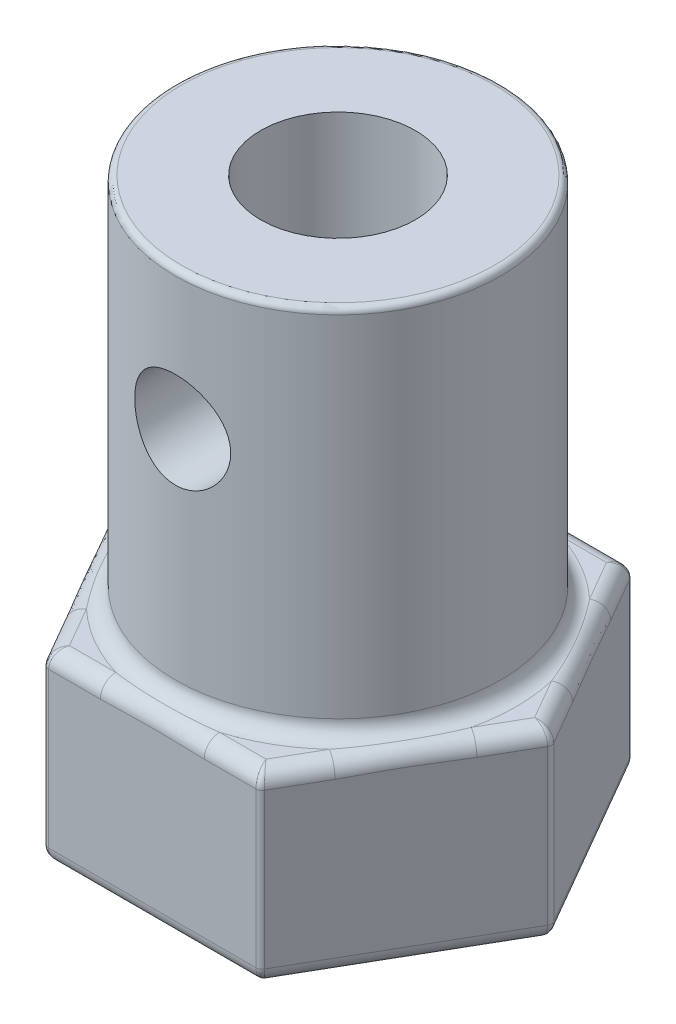
from build123d import *

# Parameters (mm, degrees)
SKETCH_1_R               = 2
EXTRUDE_1_DEPTH          = 6
SKETCH_2_R               = 5.25
SKETCH_2_R_2             = 2.5
EXTRUDE_2_DEPTH          = 12
CUT_EXTRUDE_1_DEPTH      = 21.199009877
CUT_EXTRUDE_1_DEPTH_BACK = 21.199009877
SKETCH_3_R               = 1.55
FILLET_1_R               = 0.5
FILLET_2_R               = 0.5
FILLET_3_R               = 0.2
FILLET_4_R               = 0.2


with BuildPart() as part:
    # 草图1 → 凸台-拉伸1 (new body)
    with BuildSketch(Plane(origin=(0, 0, 0), x_dir=(1, 0, 0), z_dir=(0, 1, 0))):
        Polygon((6.92820323, 0), (3.464101615, 6), (-3.464101615, 6), (-6.92820323, 0), (-3.464101615, -6), (3.464101615, -6), align=None)
        with Locations(Location((0, 0, 0), (0, 0, 270))):
            Circle(SKETCH_1_R, mode=Mode.SUBTRACT)
    extrude(amount=EXTRUDE_1_DEPTH)

    # 草图2 → 凸台-拉伸2 (add)
    with BuildSketch(Plane(origin=(0, 6, 0), x_dir=(1, 0, 0), z_dir=(0, 1, 0))):
        with Locations(Location((0, 0, 0), (0, 0, 270))):
            Circle(SKETCH_2_R)
        with Locations(Location((0, 0, 0), (0, 0, 270))):
            Circle(SKETCH_2_R_2, mode=Mode.SUBTRACT)
    extrude(amount=EXTRUDE_2_DEPTH)

    # 草图3 → 切除-拉伸1 (cut, two sides: drawn at the far end of the back side and taken through both)
    with BuildSketch(Plane.XY.offset(-CUT_EXTRUDE_1_DEPTH_BACK)):
        with Locations((0, 13.5)):
            Circle(SKETCH_3_R)
    extrude(amount=CUT_EXTRUDE_1_DEPTH + CUT_EXTRUDE_1_DEPTH_BACK, mode=Mode.SUBTRACT)

    # 圆角1
    fillet_1_edges = [part.edges().sort_by_distance(p)[0] for p in [
        (0, 6, -5.25),
    ]]
    fillet(fillet_1_edges, radius=FILLET_1_R)

    # 圆角2
    fillet_2_edges = [part.edges().sort_by_distance(p)[0] for p in [
        (0, 6, -6),
        (-5.196152423, 6, -3),
        (-5.196152423, 6, 3),
        (0, 6, 6),
        (5.196152423, 6, 3),
        (0, 0, 6),
        (-5.196152423, 0, 3),
        (-5.196152423, 0, -3),
        (0, 0, -6),
        (5.196152423, 0, -3),
        (5.196152423, 0, 3),
        (5.196152423, 6, -3),
    ]]
    fillet(fillet_2_edges, radius=FILLET_2_R)

    # 圆角3
    fillet_3_edges = [part.edges().sort_by_distance(p)[0] for p in [
        (-3.372138111, 0.134057924, 5.840714539),
        (-6.744276223, 0.134057924, 0),
        (3.372138111, 0.134057924, 5.840714539),
        (-3.372138111, 0.134057924, -5.840714539),
        (6.744276223, 0.134057924, 0),
        (3.372138111, 0.134057924, -5.840714539),
        (6.92820323, 3, 0),
        (3.464101615, 3, 6),
        (3.464101615, 3, -6),
        (-3.464101615, 3, 6),
        (-6.92820323, 3, 0),
        (-3.464101615, 3, -6),
        (-3.372138111, 5.865942076, -5.840714539),
        (-6.744276223, 5.865942076, 0),
        (3.372138111, 5.865942076, -5.840714539),
        (-3.372138111, 5.865942076, 5.840714539),
        (6.744276223, 5.865942076, 0),
        (3.372138111, 5.865942076, 5.840714539),
    ]]
    fillet(fillet_3_edges, radius=FILLET_3_R)

    # 圆角4
    fillet_4_edges = [part.edges().sort_by_distance(p)[0] for p in [
        (0, 18, -5.25),
    ]]
    fillet(fillet_4_edges, radius=FILLET_4_R)


solid = part.part
